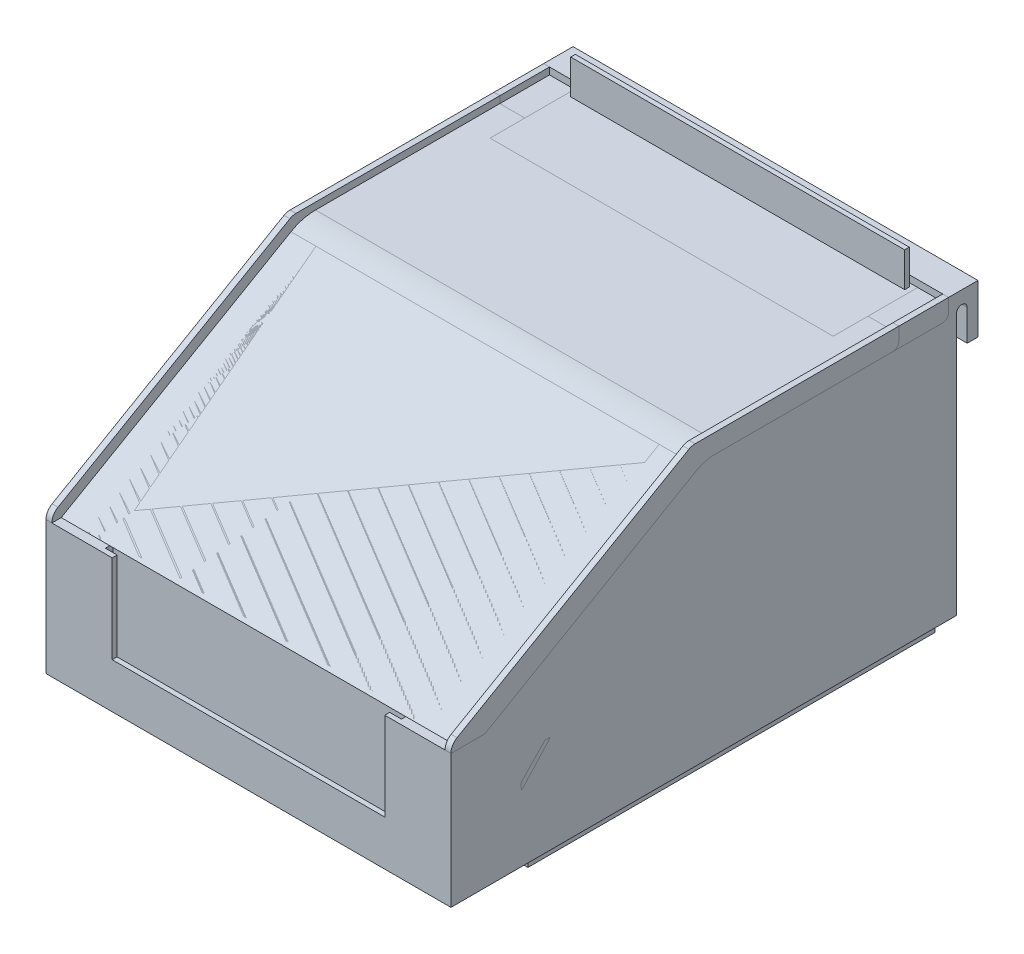
from build123d import *

# Parameters (mm, degrees)
SKETCH1_W                        = 136.525
SKETCH1_H                        = 75.692
BOSS_EXTRUDE1_DEPTH              = 52.451
CUT_EXTRUDE1_DEPTH               = 189.076537859
SKETCH3_W                        = 136.525
SKETCH3_H                        = 3.302
CUT_EXTRUDE2_DEPTH               = 189.076537859
BOSS_EXTRUDE2_START              = 8.89
BOSS_EXTRUDE2_DEPTH              = 105.41
SKETCH5_W                        = 101.854
SKETCH5_H                        = 128.905
CUT_EXTRUDE3_DEPTH               = 1.778
SKETCH6_W                        = 70.612
SKETCH6_H                        = 58.928
CUT_EXTRUDE4_DEPTH               = 3.302
SKETCH7_W                        = 76.708
SKETCH7_H                        = 61.976
CUT_EXTRUDE5_DEPTH               = 2.032
CUT_EXTRUDE6_DEPTH               = 189.076537859
BOSS_EXTRUDE8_DEPTH              = 44.45
INTERSECT2_START                 = -44.45
INTERSECT2_DEPTH                 = 88.9
INTERSECT2_START_2               = -35.306
INTERSECT2_2_DEPTH               = 70.612
INTERSECT2_START_3               = -38.354
INTERSECT2_3_DEPTH               = 76.708
INTERSECT2_START_4               = 6.477
INTERSECT2_4_OUTLINE_W           = 88.9
INTERSECT2_4_OUTLINE_H           = 122.428
INTERSECT2_4_DEPTH               = 67.437
INTERSECT2_START_5               = 37.846
INTERSECT2_5_OUTLINE_W           = 88.9
INTERSECT2_5_OUTLINE_H           = 7.952
INTERSECT2_5_OUTLINE_W_2         = 76.708
INTERSECT2_5_OUTLINE_H_2         = 2.032
INTERSECT2_5_DEPTH               = 36.068
CUT_EXTRUDE7_DEPTH               = 101.854
BOSS_EXTRUDE9_DEPTH              = 101.854
BOSS_EXTRUDE10_REACH             = 185.734
SPLIT5_SURFACE_1_BACK            = 189.077
SPLIT5_SURFACE_1_DEPTH           = 378.154
SPLIT5_SURFACE_2_BACK            = 189.077
SPLIT5_SURFACE_2_DEPTH           = 378.154
SPLIT6_START                     = -52.451
SPLIT6_DEPTH                     = 8.001
SPLIT6_2_OUTLINE_W               = 1.778
SPLIT6_2_OUTLINE_H               = 12.871807795
SPLIT6_2_DEPTH                   = 1.524
SPLIT6_START_2                   = 44.45
SPLIT6_3_DEPTH                   = 8.001
SPLIT6_START_3                   = 50.927
SPLIT6_4_OUTLINE_W               = 1.778
SPLIT6_4_OUTLINE_H               = 12.871807795
SPLIT6_4_DEPTH                   = 1.524
SPLIT6_5_DEPTH                   = 8.001
SPLIT6_6_DEPTH                   = 8.001
BOSS_EXTRUDE11_DEPTH             = 44.45
BOSS_EXTRUDE11_DEPTH_BACK        = 44.45
BOSS_EXTRUDE12_REACH             = 166.68
BOSS_EXTRUDE12_DIRECTION_2_REACH = 166.68
BOSS_EXTRUDE13_DEPTH             = 43.25
BOSS_EXTRUDE13_DEPTH_BACK        = 43.25
BOSS_EXTRUDE14_START             = -43.250000114
BOSS_EXTRUDE14_OUTLINE_W         = 1.199999886
BOSS_EXTRUDE14_OUTLINE_H         = 28.981192319
BOSS_EXTRUDE14_DEPTH             = 86.500000228
BOSS_EXTRUDE15_DEPTH             = 43.25
BOSS_EXTRUDE15_DEPTH_BACK        = 43.25
BOSS_EXTRUDE16_REACH             = 170.094
BOSS_EXTRUDE16_DIRECTION_2_REACH = 170.094
SKETCH40_W                       = 23.000000228
SKETCH40_H                       = 72.39
CUT_EXTRUDE8_DEPTH               = 169.093962393
SKETCH41_R                       = 6.35
BOSS_EXTRUDE17_DEPTH             = 104.902


with BuildPart() as part:
    # Sketch1 → Boss-Extrude1 (new, symmetric)
    with BuildSketch(Plane(origin=(0, 0, 0), x_dir=(0, 0, -1), z_dir=(1, 0, 0))):
        with Locations((-68.2625, 37.846)):
            Rectangle(SKETCH1_W, SKETCH1_H)
    extrude(amount=BOSS_EXTRUDE1_DEPTH, both=True)

    # Sketch2 → Cut-Extrude1 (cut, through all)
    with BuildSketch(Plane(origin=(52.451, 0, 0), x_dir=(0, 0, -1), z_dir=(1, 0, 0))):
        with BuildLine():
            Line((0, 0), (0, 62.992))
            Line((0, 62.992), (-2.794, 62.992))
            Line((-2.794, 62.992), (-2.794, 70.993))
            ThreePointArc((-2.794, 70.993), (-4.191, 72.39), (-5.588, 70.993))
            Line((-5.588, 70.993), (-5.588, 0))
            Line((-5.588, 0), (0, 0))
        make_face()
    extrude(amount=-CUT_EXTRUDE1_DEPTH, mode=Mode.SUBTRACT)

    # Sketch3 → Cut-Extrude2 (cut, through all)
    with BuildSketch(Plane(origin=(52.451, 0, 0), x_dir=(0, 0, -1), z_dir=(1, 0, 0))):
        with Locations((-68.2625, 1.651)):
            Rectangle(SKETCH3_W, SKETCH3_H)
    extrude(amount=-CUT_EXTRUDE2_DEPTH, mode=Mode.SUBTRACT)

    # Sketch4 → Boss-Extrude2 (add)
    with BuildSketch(Plane.XY.offset(BOSS_EXTRUDE2_START)):
        Polygon((42.291, 0), (50.165, 0), (50.165, 3.302), (38.989, 3.302), align=None)
        Polygon((-42.291, 0), (-50.165, 0), (-50.165, 3.302), (-38.989, 3.302), align=None)
    extrude(amount=BOSS_EXTRUDE2_DEPTH)

    # Sketch5 → Cut-Extrude3 (cut)
    with BuildSketch(Plane(origin=(0, 75.692, 0), x_dir=(1, 0, 0), z_dir=(0, 1, 0))):
        with Locations((0, -72.0725)):
            Rectangle(SKETCH5_W, SKETCH5_H)
    extrude(amount=-CUT_EXTRUDE3_DEPTH, mode=Mode.SUBTRACT)

    # Sketch6 → Cut-Extrude4 (cut)
    with BuildSketch(Plane.XY.offset(136.525)):
        with Locations((0, 44.45)):
            Rectangle(SKETCH6_W, SKETCH6_H)
    extrude(amount=-CUT_EXTRUDE4_DEPTH, mode=Mode.SUBTRACT)

    # Sketch7 → Cut-Extrude5 (cut)
    with BuildSketch(Plane.XY.offset(133.223)):
        with Locations((0, 42.926)):
            Rectangle(SKETCH7_W, SKETCH7_H)
    extrude(amount=CUT_EXTRUDE5_DEPTH, mode=Mode.SUBTRACT)

    # Sketch8 → Cut-Extrude6 (cut, through all)
    with BuildSketch(Plane(origin=(52.451, 0, 0), x_dir=(0, 0, -1), z_dir=(1, 0, 0))):
        with BuildLine():
            Line((-136.525, 75.692), (-136.525, 37.846))
            ThreePointArc((-136.525, 37.846), (-136.099630657, 39.4335), (-134.9375, 40.595630657))
            Line((-134.9375, 40.595630657), (-74.885566451, 75.266630657))
            ThreePointArc((-74.885566451, 75.266630657), (-74.119816919, 75.583814498), (-73.298066451, 75.692))
            Line((-73.298066451, 75.692), (-136.525, 75.692))
        make_face()
    extrude(amount=-CUT_EXTRUDE6_DEPTH, mode=Mode.SUBTRACT)

    # Intersect2 4 outline → Intersect2 4 (cut)
    with BuildSketch(Plane(origin=(0, 0, 0), x_dir=(1, 0, 0), z_dir=(0, 1, 0)).offset(INTERSECT2_START_4)):
        with Locations((0, -68.834)):
            Rectangle(INTERSECT2_4_OUTLINE_W, INTERSECT2_4_OUTLINE_H)
    extrude(amount=INTERSECT2_4_DEPTH, mode=Mode.SUBTRACT)

    # Intersect2 5 outline → Intersect2 5 (cut)
    with BuildSketch(Plane(origin=(0, 0, 0), x_dir=(1, 0, 0), z_dir=(0, 1, 0)).offset(INTERSECT2_START_5)):
        with Locations((0, -134.024)):
            Rectangle(INTERSECT2_5_OUTLINE_W, INTERSECT2_5_OUTLINE_H)
        with Locations((0, -134.239)):
            Rectangle(INTERSECT2_5_OUTLINE_W_2, INTERSECT2_5_OUTLINE_H_2, mode=Mode.SUBTRACT)
    extrude(amount=INTERSECT2_5_DEPTH, mode=Mode.SUBTRACT)


with BuildPart() as body_2:
    # Sketch21 → Boss-Extrude8 (new, symmetric)
    with BuildSketch(Plane(origin=(0, 0, 0), x_dir=(0, 0, -1), z_dir=(1, 0, 0))):
        Polygon((-130.048, 6.477), (-7.62, 6.477), (-7.62, 75.692), (-136.525, 75.692), (-136.525, 37.846), (-130.048, 37.846), align=None)
    extrude(amount=BOSS_EXTRUDE8_DEPTH, both=True)

    # Intersect2: read off the stored shape, not the designer's step
    # Intersect2 outline → Intersect2 (cut)
    with BuildSketch(Plane.YZ.offset(INTERSECT2_START)):
        with BuildLine():
            ThreePointArc((37.846, 136.525), (39.4335, 136.099630657), (40.595630657, 134.9375))
            Line((40.595630657, 134.9375), (73.914, 77.228391473))
            Line((73.914, 77.228391473), (73.914, 7.62))
            Line((73.914, 7.62), (75.692, 7.62))
            Line((75.692, 7.62), (75.692, 136.525))
            Line((75.692, 136.525), (37.846, 136.525))
        make_face()
    extrude(amount=INTERSECT2_DEPTH, mode=Mode.SUBTRACT)

    # Intersect2 2 outline → Intersect2 2 (cut)
    with BuildSketch(Plane.YZ.offset(INTERSECT2_START_2)):
        with BuildLine():
            Line((41.585497694, 133.223), (40.595630657, 134.9375))
            ThreePointArc((40.595630657, 134.9375), (39.4335, 136.099630657), (37.846, 136.525))
            Line((37.846, 136.525), (37.846, 133.223))
            Line((37.846, 133.223), (41.585497694, 133.223))
        make_face()
    extrude(amount=INTERSECT2_2_DEPTH, mode=Mode.SUBTRACT)

    # Intersect2 3 outline → Intersect2 3 (cut)
    with BuildSketch(Plane.YZ.offset(INTERSECT2_START_3)):
        with BuildLine():
            Line((41.585497694, 133.223), (40.595630657, 134.9375))
            ThreePointArc((40.595630657, 134.9375), (40.495575378, 135.099392842), (40.386, 135.255))
            Line((40.386, 135.255), (37.846, 135.255))
            Line((37.846, 135.255), (37.846, 133.223))
            Line((37.846, 133.223), (41.585497694, 133.223))
        make_face()
    extrude(amount=INTERSECT2_3_DEPTH, mode=Mode.SUBTRACT)


with BuildPart() as cut_extrude7_tool:
    # Sketch19 → Cut-Extrude7 (new body)
    with BuildSketch(Plane.ZY.offset(-50.927)):
        with BuildLine():
            Line((7.62, 75.692), (136.525, 75.692))
            Line((136.525, 75.692), (136.525, 37.846))
            Line((136.525, 37.846), (134.112, 37.846))
            Line((134.112, 37.846), (74.587436729, 72.212522628))
            ThreePointArc((74.587436729, 72.212522628), (71.524438602, 73.481257994), (68.237436729, 73.914))
            Line((68.237436729, 73.914), (7.62, 73.914))
            Line((7.62, 73.914), (7.62, 75.692))
        make_face()
    extrude(amount=CUT_EXTRUDE7_DEPTH)


with BuildPart() as part_1:
    add(part.part)

    # Cut-Extrude7: cut by cut_extrude7_tool
    add(cut_extrude7_tool.part, mode=Mode.SUBTRACT)


with BuildPart() as body_2_1:
    add(body_2.part)

    # Cut-Extrude7: cut by cut_extrude7_tool
    add(cut_extrude7_tool.part, mode=Mode.SUBTRACT)


with BuildPart() as body_3:
    # Sketch22 → Boss-Extrude9 (new body)
    with BuildSketch(Plane.ZY.offset(-50.927)):
        with BuildLine():
            Line((134.112, 37.846), (74.587436729, 72.212522628))
            ThreePointArc((74.587436729, 72.212522628), (71.524438602, 73.481257994), (68.237436729, 73.914))
            Line((68.237436729, 73.914), (29.50020025, 73.914))
            Line((29.50020025, 73.914), (27.904375071, 72.992649904))
            ThreePointArc((27.904375071, 72.992649904), (27.785291968, 72.943324067), (27.657500057, 72.926499943))
            Line((27.657500057, 72.926499943), (27.657500057, 71.726500057))
            ThreePointArc((27.657500057, 71.726500057), (27.785291968, 71.709675933), (27.904375071, 71.660350096))
            Line((27.904375071, 71.660350096), (29.50020025, 70.739))
            Line((29.50020025, 70.739), (68.237436729, 70.739))
            ThreePointArc((68.237436729, 70.739), (70.702688133, 70.414443495), (72.999936729, 69.462891971))
            Line((72.999936729, 69.462891971), (127.762, 37.846))
            Line((127.762, 37.846), (134.112, 37.846))
        make_face()
    extrude(amount=BOSS_EXTRUDE9_DEPTH)


with BuildPart() as body_4:

    # Sketch23 → Boss-Extrude10 (new, up to next)
    with BuildSketch(Plane.ZY.offset(-44.45), mode=Mode.PRIVATE) as boss_extrude10_sk1:
        with BuildLine():
            Line((9.807499943, 53.876499943), (8.607500057, 53.876499943))
            ThreePointArc((8.607500057, 53.876499943), (8.113750028, 53.382749914), (7.62, 53.876499943))
            Line((7.62, 53.876499943), (7.62, 6.477))
            Line((7.62, 6.477), (10.795, 6.477))
            Line((10.795, 6.477), (10.795, 52.03379975))
            Line((10.795, 52.03379975), (9.873649904, 53.629624929))
            ThreePointArc((9.873649904, 53.629624929), (9.824324067, 53.748708032), (9.807499943, 53.876499943))
        make_face()
    boss_extrude10_tool1 = extrude(boss_extrude10_sk1.sketch, amount=BOSS_EXTRUDE10_REACH, mode=Mode.PRIVATE) - part_1.part
    add(boss_extrude10_tool1.solids().sort_by_distance((44.45, 29.965741, 9.202231))[0])


with BuildPart() as body_5:
    # Split5: the piece behind the surface
    add(part_1.part)
    # Split5 surface: a surface, the sketch's curves swept straight by 378.154 mm
    with BuildLine(Plane(origin=(52.451, 0, 0), x_dir=(0, 0, -1), z_dir=(1, 0, 0)).offset(-SPLIT5_SURFACE_1_BACK), mode=Mode.PRIVATE) as split5_surface_1_path:
        Line((-7.62, 75.692), (-7.62, 72.3265))
        ThreePointArc((-7.62, 72.3265), (-8.084967985, 71.203967985), (-9.2075, 70.739))
        Line((-9.2075, 70.739), (-68.237436729, 70.739))
        ThreePointArc((-68.237436729, 70.739), (-70.702688133, 70.414443495), (-72.999936729, 69.462891971))
        Line((-72.999936729, 69.462891971), (-127.762, 37.846))
        Line((-127.762, 37.846), (-136.525, 37.846))
    split5_surface_1 = Shell.extrude(split5_surface_1_path.wire(), (1 * SPLIT5_SURFACE_1_DEPTH, 0 * SPLIT5_SURFACE_1_DEPTH, 0 * SPLIT5_SURFACE_1_DEPTH))
    split(bisect_by=split5_surface_1, keep=Keep.BOTTOM)

    # Split6 5 outline → Split6 5 (cut)
    with BuildSketch(Plane.YZ.offset(SPLIT6_START)):
        with BuildLine():
            ThreePointArc((72.3265, 20.491807795), (71.203967985, 20.95677578), (70.739, 22.079307795))
            Line((70.739, 22.079307795), (70.739, 9.2075))
            ThreePointArc((70.739, 9.2075), (71.203967985, 8.084967985), (72.3265, 7.62))
            Line((72.3265, 7.62), (75.692, 7.62))
            Line((75.692, 7.62), (75.692, 20.491807795))
            Line((75.692, 20.491807795), (72.3265, 20.491807795))
        make_face()
    extrude(amount=SPLIT6_5_DEPTH, mode=Mode.SUBTRACT)

    # Split6 6 outline → Split6 6 (cut)
    with BuildSketch(Plane.YZ.offset(SPLIT6_START_2)):
        with BuildLine():
            ThreePointArc((72.3265, 20.491807795), (71.203967985, 20.95677578), (70.739, 22.079307795))
            Line((70.739, 22.079307795), (70.739, 9.2075))
            ThreePointArc((70.739, 9.2075), (71.203967985, 8.084967985), (72.3265, 7.62))
            Line((72.3265, 7.62), (75.692, 7.62))
            Line((75.692, 7.62), (75.692, 20.491807795))
            Line((75.692, 20.491807795), (72.3265, 20.491807795))
        make_face()
    extrude(amount=SPLIT6_6_DEPTH, mode=Mode.SUBTRACT)


with BuildPart() as part_2:
    add(part_1.part)

    # Split5: split by a surface, the side it looks to stays
    # Split5 surface: a surface, the sketch's curves swept straight by 378.154 mm
    with BuildLine(Plane(origin=(52.451, 0, 0), x_dir=(0, 0, -1), z_dir=(1, 0, 0)).offset(-SPLIT5_SURFACE_2_BACK), mode=Mode.PRIVATE) as split5_surface_2_path:
        Line((-7.62, 75.692), (-7.62, 72.3265))
        ThreePointArc((-7.62, 72.3265), (-8.084967985, 71.203967985), (-9.2075, 70.739))
        Line((-9.2075, 70.739), (-68.237436729, 70.739))
        ThreePointArc((-68.237436729, 70.739), (-70.702688133, 70.414443495), (-72.999936729, 69.462891971))
        Line((-72.999936729, 69.462891971), (-127.762, 37.846))
        Line((-127.762, 37.846), (-136.525, 37.846))
    split5_surface_2 = Shell.extrude(split5_surface_2_path.wire(), (1 * SPLIT5_SURFACE_2_DEPTH, 0 * SPLIT5_SURFACE_2_DEPTH, 0 * SPLIT5_SURFACE_2_DEPTH))
    split(bisect_by=split5_surface_2, keep=Keep.TOP)

    # Combine3: union body 4
    add(body_4.part)


with BuildPart() as body_6:
    # Split6: read off the stored shape, not the designer's step
    # Split6 outline → Split6 (new body)
    with BuildSketch(Plane.YZ.offset(SPLIT6_START)):
        with BuildLine():
            Line((73.914, 20.491807795), (72.3265, 20.491807795))
            ThreePointArc((72.3265, 20.491807795), (71.203967985, 20.95677578), (70.739, 22.079307795))
            Line((70.739, 22.079307795), (70.739, 9.2075))
            ThreePointArc((70.739, 9.2075), (71.203967985, 8.084967985), (72.3265, 7.62))
            Line((72.3265, 7.62), (73.914, 7.62))
            Line((73.914, 7.62), (73.914, 20.491807795))
        make_face()
    extrude(amount=SPLIT6_DEPTH)

    # Split6 2 outline → Split6 2 (add)
    with BuildSketch(Plane.YZ.offset(SPLIT6_START)):
        with Locations((74.803, 14.055903898)):
            Rectangle(SPLIT6_2_OUTLINE_W, SPLIT6_2_OUTLINE_H)
    extrude(amount=SPLIT6_2_DEPTH)


with BuildPart() as body_7:
    # Split6 3 outline → Split6 3 (new body)
    with BuildSketch(Plane.YZ.offset(SPLIT6_START_2)):
        with BuildLine():
            Line((73.914, 20.491807795), (72.3265, 20.491807795))
            ThreePointArc((72.3265, 20.491807795), (71.203967985, 20.95677578), (70.739, 22.079307795))
            Line((70.739, 22.079307795), (70.739, 9.2075))
            ThreePointArc((70.739, 9.2075), (71.203967985, 8.084967985), (72.3265, 7.62))
            Line((72.3265, 7.62), (73.914, 7.62))
            Line((73.914, 7.62), (73.914, 20.491807795))
        make_face()
    extrude(amount=SPLIT6_3_DEPTH)

    # Split6 4 outline → Split6 4 (add)
    with BuildSketch(Plane.YZ.offset(SPLIT6_START_3)):
        with Locations((74.803, 14.055903898)):
            Rectangle(SPLIT6_4_OUTLINE_W, SPLIT6_4_OUTLINE_H)
    extrude(amount=SPLIT6_4_DEPTH)


with BuildPart() as body_3_1:
    add(body_3.part)

    # Combine2: read off the stored shape, not the designer's step
    # Combine2: union body 5
    add(body_5.part)


with BuildPart() as body_6_2:
    # Sketch34 → Boss-Extrude11 (new, two sides: drawn at the far end of the back side and taken through both)
    with BuildSketch(Plane(origin=(0, 0, 0), x_dir=(0, 0, -1), z_dir=(1, 0, 0)).offset(-BOSS_EXTRUDE11_DEPTH_BACK)):
        Polygon((-9.807499943, 53.876499943), (-9.807499943, 52.144200174), (-10.395000038, 51.12662016), (-10.395000038, 41.176499943), (-8.019999962, 41.176499943), (-8.019999962, 51.12662016), (-8.607500057, 52.144200174), (-8.607500057, 53.876499943), align=None)
    extrude(amount=BOSS_EXTRUDE11_DEPTH + BOSS_EXTRUDE11_DEPTH_BACK)


with BuildPart() as body_7_2:

    # Boss-Extrude12: up to this face of the body (flat: up to its plane)
    boss_extrude12_end = Plane(body_2_1.part.faces().sort_by_distance((44.45, 37.147196614, 63.223853408))[0])
    # Sketch35 → Boss-Extrude12 (new, up to the picked face)
    with BuildSketch(Plane(origin=(0, 0, 0), x_dir=(0, 0, -1), z_dir=(1, 0, 0)), mode=Mode.PRIVATE) as boss_extrude12_sk1:
        Polygon((-40.357500057, 73.514000038), (-40.357500057, 71.138999962), (-30.40737984, 71.138999962), (-29.389799826, 71.726500057), (-27.657500057, 71.726500057), (-27.657500057, 72.926499943), (-29.389799826, 72.926499943), (-30.40737984, 73.514000038), align=None)
    boss_extrude12_tool1 = split(extrude(boss_extrude12_sk1.sketch, amount=BOSS_EXTRUDE12_REACH, mode=Mode.PRIVATE), bisect_by=boss_extrude12_end, keep=Keep.BOTH, mode=Mode.PRIVATE)
    add(boss_extrude12_tool1.solids().sort_by(Axis((0, 72.3265, 34.505877), (1, 0, 0)))[0])


    # Boss-Extrude12 direction 2: up to this face of the body (flat: up to its plane)
    boss_extrude12_direction_2_end = Plane(body_2_1.part.faces().sort_by_distance((-44.45, 37.147196614, 63.223853408))[0])
    # Sketch35 → Boss-Extrude12 direction 2 (add, up to the picked face)
    with BuildSketch(Plane(origin=(0, 0, 0), x_dir=(0, 0, -1), z_dir=(1, 0, 0)), mode=Mode.PRIVATE) as boss_extrude12_direction_2_sk1:
        Polygon((-40.357500057, 73.514000038), (-40.357500057, 71.138999962), (-30.40737984, 71.138999962), (-29.389799826, 71.726500057), (-27.657500057, 71.726500057), (-27.657500057, 72.926499943), (-29.389799826, 72.926499943), (-30.40737984, 73.514000038), align=None)
    boss_extrude12_direction_2_tool1 = split(extrude(boss_extrude12_direction_2_sk1.sketch, amount=-BOSS_EXTRUDE12_DIRECTION_2_REACH, mode=Mode.PRIVATE), bisect_by=boss_extrude12_direction_2_end, keep=Keep.BOTH, mode=Mode.PRIVATE)
    add(boss_extrude12_direction_2_tool1.solids().sort_by(Axis((0, 72.3265, 34.505877), (-1, 0, 0)))[0])


with BuildPart() as body_8:
    # Sketch36 → Boss-Extrude13 (new, two sides: drawn at the far end of the back side and taken through both)
    with BuildSketch(Plane(origin=(0, 0, 0), x_dir=(0, 0, -1), z_dir=(1, 0, 0)).offset(-BOSS_EXTRUDE13_DEPTH_BACK)):
        with BuildLine():
            Line((-8.607500057, 53.876499943), (-9.807499943, 53.876499943))
            ThreePointArc((-9.807499943, 53.876499943), (-15.035643932, 66.498356068), (-27.657500057, 71.726500057))
            Line((-27.657500057, 71.726500057), (-27.657500057, 72.926499943))
            ThreePointArc((-27.657500057, 72.926499943), (-14.187115875, 67.346884125), (-8.607500057, 53.876499943))
        make_face()
    extrude(amount=BOSS_EXTRUDE13_DEPTH + BOSS_EXTRUDE13_DEPTH_BACK)


with BuildPart() as body_9:
    # Boss-Extrude14: read off the stored shape, not the designer's step
    # Boss-Extrude14 outline → Boss-Extrude14 (new body)
    with BuildSketch(Plane(origin=(0, 0, 0), x_dir=(0, 0, -1), z_dir=(1, 0, 0)).offset(BOSS_EXTRUDE14_START)):
        with Locations((-9.2075, 68.367096102)):
            Rectangle(BOSS_EXTRUDE14_OUTLINE_W, BOSS_EXTRUDE14_OUTLINE_H)
    extrude(amount=BOSS_EXTRUDE14_DEPTH)


with BuildPart() as body_10:
    # Sketch38 → Boss-Extrude15 (new, two sides: drawn at the far end of the back side and taken through both)
    with BuildSketch(Plane(origin=(0, 0, 0), x_dir=(0, 0, -1), z_dir=(1, 0, 0)).offset(-BOSS_EXTRUDE15_DEPTH_BACK)):
        Polygon((-127.762, 37.846), (-114.173, 45.691612808), (-114.173, 38.894253114), (-107.823, 39.116), (-107.823, 37.846), (-112.903, 32.766), (-123.698, 32.766), (-123.698, 37.846), align=None)
    extrude(amount=BOSS_EXTRUDE15_DEPTH + BOSS_EXTRUDE15_DEPTH_BACK)


with BuildPart() as body_11:

    # Boss-Extrude16: up to this face of the body (flat: up to its plane)
    boss_extrude16_end = Plane(body_10.part.faces().sort_by_distance((43.25, 37.71009184, 117.330546941))[0])
    # Sketch39 → Boss-Extrude16 (new, up to the picked face)
    with BuildSketch(Plane(origin=(0, 0, 0), x_dir=(0, 0, -1), z_dir=(1, 0, 0)), mode=Mode.PRIVATE) as boss_extrude16_sk1:
        with BuildLine():
            Line((-112.141, 41.656), (-112.141, 39.116))
            Line((-112.141, 39.116), (-105.791, 39.337746886))
            Line((-105.791, 39.337746886), (-105.791, 36.576))
            ThreePointArc((-105.791, 36.576), (-107.814718313, 31.270891351), (-112.857572037, 28.661439319))
            ThreePointArc((-112.857572037, 28.661439319), (-117.933764284, 19.750772991), (-107.901475937, 17.624533901))
            ThreePointArc((-107.901475937, 17.624533901), (-101.652151641, 26.198889126), (-99.441, 36.576))
            Line((-99.441, 36.576), (-99.441, 45.466))
            Line((-99.441, 45.466), (-105.541886423, 45.466))
            Line((-105.541886423, 45.466), (-112.141, 41.656))
        make_face()
    boss_extrude16_tool1 = split(extrude(boss_extrude16_sk1.sketch, amount=BOSS_EXTRUDE16_REACH, mode=Mode.PRIVATE), bisect_by=boss_extrude16_end, keep=Keep.BOTH, mode=Mode.PRIVATE)
    add(boss_extrude16_tool1.solids().sort_by(Axis((0, 29.830831, 107.575887), (1, 0, 0)))[0])


    # Boss-Extrude16 direction 2: up to this face of the body (flat: up to its plane)
    boss_extrude16_direction_2_end = Plane(body_10.part.faces().sort_by_distance((-43.25, 37.71009184, 117.330546941))[0])
    # Sketch39 → Boss-Extrude16 direction 2 (add, up to the picked face)
    with BuildSketch(Plane(origin=(0, 0, 0), x_dir=(0, 0, -1), z_dir=(1, 0, 0)), mode=Mode.PRIVATE) as boss_extrude16_direction_2_sk1:
        with BuildLine():
            Line((-112.141, 41.656), (-112.141, 39.116))
            Line((-112.141, 39.116), (-105.791, 39.337746886))
            Line((-105.791, 39.337746886), (-105.791, 36.576))
            ThreePointArc((-105.791, 36.576), (-107.814718313, 31.270891351), (-112.857572037, 28.661439319))
            ThreePointArc((-112.857572037, 28.661439319), (-117.933764284, 19.750772991), (-107.901475937, 17.624533901))
            ThreePointArc((-107.901475937, 17.624533901), (-101.652151641, 26.198889126), (-99.441, 36.576))
            Line((-99.441, 36.576), (-99.441, 45.466))
            Line((-99.441, 45.466), (-105.541886423, 45.466))
            Line((-105.541886423, 45.466), (-112.141, 41.656))
        make_face()
    boss_extrude16_direction_2_tool1 = split(extrude(boss_extrude16_direction_2_sk1.sketch, amount=-BOSS_EXTRUDE16_DIRECTION_2_REACH, mode=Mode.PRIVATE), bisect_by=boss_extrude16_direction_2_end, keep=Keep.BOTH, mode=Mode.PRIVATE)
    add(boss_extrude16_direction_2_tool1.solids().sort_by(Axis((0, 29.830831, 107.575887), (-1, 0, 0)))[0])


with BuildPart() as cut_extrude8_tool:
    # Sketch40 → Cut-Extrude8 (new, through all)
    with BuildSketch(Plane.XY):
        with Locations((0, 39.497)):
            Rectangle(SKETCH40_W, SKETCH40_H)
    extrude(amount=CUT_EXTRUDE8_DEPTH)


with BuildPart() as body_10_1:
    add(body_10.part)

    # Cut-Extrude8: cut by cut_extrude8_tool
    add(cut_extrude8_tool.part, mode=Mode.SUBTRACT)


with BuildPart() as body_11_1:
    add(body_11.part)

    # Cut-Extrude8: cut by cut_extrude8_tool
    add(cut_extrude8_tool.part, mode=Mode.SUBTRACT)


with BuildPart() as cut_extrude8_piece_1:
    # of the separate pieces the step leaves, piece 1, a body of its own (cut_extrude8_pieces)
    add(body_10_1.part.solids().sort_by_distance((-43.25, 37.846, 127.762))[0])


with BuildPart() as cut_extrude8_piece_2:
    # of the separate pieces the step leaves, piece 2, a body of its own (cut_extrude8_pieces)
    add(body_10_1.part.solids().sort_by_distance((11.500000114, 37.846, 127.762))[0])


with BuildPart() as cut_extrude8_piece_1_of_body_11:
    # of the separate pieces the step leaves, piece 1, a body of its own (cut_extrude8_pieces_of_body_11)
    add(body_11_1.part.solids().sort_by_distance((-43.25, 39.116, 112.141))[0])


with BuildPart() as cut_extrude8_piece_2_of_body_11:
    # of the separate pieces the step leaves, piece 2, a body of its own (cut_extrude8_pieces_of_body_11)
    add(body_11_1.part.solids().sort_by_distance((11.500000114, 39.116, 112.141))[0])


    add(cut_extrude8_piece_1_of_body_11.part)  # Boss-Extrude17 merges Cut-Extrude8 piece 1 of body 11
    # Sketch41 → Boss-Extrude17 (add)
    with BuildSketch(Plane(origin=(52.451, 0, 0), x_dir=(0, 0, -1), z_dir=(1, 0, 0))):
        with Locations((-112.141, 22.352)):
            Circle(SKETCH41_R)
    extrude(amount=-BOSS_EXTRUDE17_DEPTH)


solid = Compound([body_2_1.part, part_2.part, body_6.part, body_7.part, body_3_1.part, body_6_2.part, body_7_2.part, body_8.part, body_9.part, cut_extrude8_piece_1.part, cut_extrude8_piece_2.part, cut_extrude8_piece_2_of_body_11.part])
